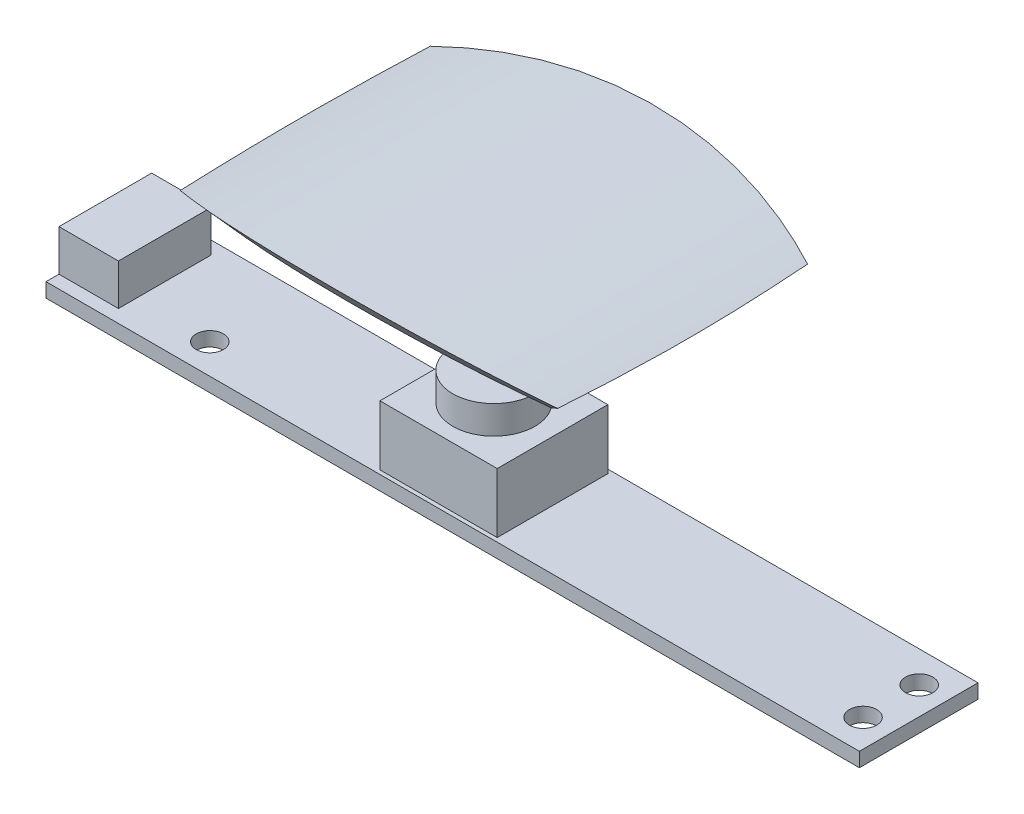
from build123d import *

# Parameters (mm, degrees)
SKETCH1_W                = 62.1792
SKETCH1_H                = 9.0678
SKETCH1_R                = 1.0414
BOSS_EXTRUDE1_DEPTH      = 1.0922
SKETCH2_W                = 4.5466
SKETCH2_H                = 7.0866
BOSS_EXTRUDE2_DEPTH      = 3.1496
SKETCH3_W                = 8.9662
SKETCH3_H                = 8.4582
BOSS_EXTRUDE3_DEPTH      = 4.572
BOSS_EXTRUDE4_DEPTH      = 2.159
BOSS_EXTRUDE5_DEPTH      = 50.8
BOSS_EXTRUDE5_DEPTH_BACK = 50.8
SKETCH11_R               = 52.324
SKETCH11_R_2             = 50.8


with BuildPart() as part:
    # Sketch1 → Boss-Extrude1 (new body)
    with BuildSketch(Plane(origin=(0, 0, 0), x_dir=(1, 0, 0), z_dir=(0, 1, 0))):
        with Locations((31.0896, 4.5339)):
            Rectangle(SKETCH1_W, SKETCH1_H)
        with Locations(Location((10.2362, 2.286, 0), (0, 0, 270))):
            Circle(SKETCH1_R, mode=Mode.SUBTRACT)
        with Locations(Location((60.071, 6.6802, 0), (0, 0, 270))):
            Circle(SKETCH1_R, mode=Mode.SUBTRACT)
        with Locations(Location((60.071, 2.3876, 0), (0, 0, 270))):
            Circle(SKETCH1_R, mode=Mode.SUBTRACT)
    extrude(amount=BOSS_EXTRUDE1_DEPTH)

    # Sketch2 → Boss-Extrude2 (add)
    with BuildSketch(Plane(origin=(0, 1.0922, 0), x_dir=(1, 0, 0), z_dir=(0, 1, 0))):
        with Locations((2.2733, 4.5339)):
            Rectangle(SKETCH2_W, SKETCH2_H)
    extrude(amount=BOSS_EXTRUDE2_DEPTH)

    # Sketch3 → Boss-Extrude3 (add)
    with BuildSketch(Plane(origin=(0, 1.0922, 0), x_dir=(1, 0, 0), z_dir=(0, 1, 0))):
        with Locations((29.7053, 4.5339)):
            Rectangle(SKETCH3_W, SKETCH3_H)
    extrude(amount=BOSS_EXTRUDE3_DEPTH)

    # Sketch4 → Boss-Extrude4 (add)
    with BuildSketch(Plane(origin=(0, 5.6642, 0), x_dir=(1, 0, 0), z_dir=(0, 1, 0))):
        with BuildLine():
            ThreePointArc((32.8422, 4.5339), (30.863379034, 7.449203511), (27.423477974, 6.686440325))
            Line((27.423477974, 6.686440325), (31.987122026, 2.381359675))
            ThreePointArc((31.987122026, 2.381359675), (32.620603511, 3.375820966), (32.8422, 4.5339))
        make_face()
        with BuildLine():
            Line((31.987122026, 2.381359675), (27.423477974, 6.686440325))
            ThreePointArc((27.423477974, 6.686440325), (27.552759675, 2.252077974), (31.987122026, 2.381359675))
        make_face()
    extrude(amount=BOSS_EXTRUDE4_DEPTH)


with BuildPart() as body_2:
    # Loft1: read off the stored shape, not the designer's step
    # Loft1: loft between two sections, ruled curve by curve
    loft1_from = [
        Edge.make_bspline([(-17.815038703, 43.7642, -36.004399795), (-13.855010478, 43.7642, -36.004399795), (-9.894982253, 43.7642, -36.004399795), (-1.974925802, 43.7642, -36.004399795), (1.985102423, 43.7642, -36.004399795), (9.905158874, 43.7642, -36.004399795), (13.865187099, 43.7642, -36.004399795), (21.785243549, 43.7642, -36.004399795), (25.745271775, 43.7642, -36.004399795), (33.665328225, 43.7642, -36.004399795), (37.625356451, 43.7642, -36.004399795), (45.545412901, 43.7642, -36.004399795), (49.505441126, 43.7642, -36.004399795), (57.425497577, 43.7642, -36.004399795), (61.385525802, 43.7642, -36.004399795), (69.305582253, 43.7642, -36.004399795), (73.265610478, 43.7642, -36.004399795), (77.225638703, 43.7642, -36.004399795)], [0, 0, 0, 0, 0.125, 0.125, 0.25, 0.25, 0.375, 0.375, 0.5, 0.5, 0.625, 0.625, 0.75, 0.75, 0.875, 0.875, 1, 1, 1, 1], 3),
        Edge.make_bspline([(77.225638703, 43.7642, -36.004399795), (77.225638703, 43.7642, -30.759316496), (77.225638703, 43.7642, -25.514233197), (77.225638703, 43.7642, -15.024066598), (77.225638703, 43.7642, -9.778983299), (77.225638703, 43.7642, 0.711183299), (77.225638703, 43.7642, 5.956266598), (77.225638703, 43.7642, 16.446433197), (77.225638703, 43.7642, 21.691516496), (77.225638703, 43.7642, 26.936599795)], [0, 0, 0, 0, 0.25, 0.25, 0.5, 0.5, 0.75, 0.75, 1, 1, 1, 1], 3),
        Edge.make_bspline([(-17.815038703, 43.7642, 26.936599795), (-17.815038703, 43.7642, 21.691516496), (-17.815038703, 43.7642, 16.446433197), (-17.815038703, 43.7642, 5.956266598), (-17.815038703, 43.7642, 0.711183299), (-17.815038703, 43.7642, -9.778983299), (-17.815038703, 43.7642, -15.024066598), (-17.815038703, 43.7642, -25.514233197), (-17.815038703, 43.7642, -30.759316496), (-17.815038703, 43.7642, -36.004399795)], [0, 0, 0, 0, 0.25, 0.25, 0.5, 0.5, 0.75, 0.75, 1, 1, 1, 1], 3),
        Edge.make_bspline([(77.225638703, 43.7642, 26.936599795), (73.265610478, 43.7642, 26.936599795), (69.305582253, 43.7642, 26.936599795), (61.385525802, 43.7642, 26.936599795), (57.425497577, 43.7642, 26.936599795), (49.505441126, 43.7642, 26.936599795), (45.545412901, 43.7642, 26.936599795), (37.625356451, 43.7642, 26.936599795), (33.665328225, 43.7642, 26.936599795), (25.745271775, 43.7642, 26.936599795), (21.785243549, 43.7642, 26.936599795), (13.865187099, 43.7642, 26.936599795), (9.905158874, 43.7642, 26.936599795), (1.985102423, 43.7642, 26.936599795), (-1.974925802, 43.7642, 26.936599795), (-9.894982253, 43.7642, 26.936599795), (-13.855010478, 43.7642, 26.936599795), (-17.815038703, 43.7642, 26.936599795)], [0, 0, 0, 0, 0.125, 0.125, 0.25, 0.25, 0.375, 0.375, 0.5, 0.5, 0.625, 0.625, 0.75, 0.75, 0.875, 0.875, 1, 1, 1, 1], 3),
    ]
    loft1_to = [
        Edge.make_bspline([(27.089926276, 7.8232, -6.265939807), (27.210266192, 7.8232, -6.447652637), (27.356593228, 7.8232, -6.627246031), (27.704874025, 7.8232, -6.962236266), (27.906975354, 7.8232, -7.117459947), (28.360359335, 7.8232, -7.379930242), (28.611638214, 7.8232, -7.486888917), (29.143809422, 7.8232, -7.63244288), (29.424466589, 7.8232, -7.6708), (29.986133411, 7.8232, -7.6708), (30.266790578, 7.8232, -7.63244288), (30.798961786, 7.8232, -7.486888917), (31.050240665, 7.8232, -7.379930242), (31.503624646, 7.8232, -7.117459947), (31.705725975, 7.8232, -6.962236266), (32.054006772, 7.8232, -6.627246031), (32.200333808, 7.8232, -6.447652637), (32.320673724, 7.8232, -6.265939807)], [0, 0, 0, 0, 0.125, 0.125, 0.25, 0.25, 0.375, 0.375, 0.5, 0.5, 0.625, 0.625, 0.75, 0.75, 0.875, 0.875, 1, 1, 1, 1], 3),
        Edge.make_bspline([(32.320673724, 7.8232, -6.265939807), (32.480064731, 7.8232, -6.025259974), (32.612503267, 7.8232, -5.751723137), (32.793795146, 7.8232, -5.163282045), (32.8422, 7.8232, -4.848745684), (32.8422, 7.8232, -4.219054316), (32.793795146, 7.8232, -3.904517955), (32.612503267, 7.8232, -3.316076863), (32.480064731, 7.8232, -3.042540026), (32.320673724, 7.8232, -2.801860193)], [0, 0, 0, 0, 0.25, 0.25, 0.5, 0.5, 0.75, 0.75, 1, 1, 1, 1], 3),
        Edge.make_bspline([(27.089926276, 7.8232, -2.801860193), (26.930535269, 7.8232, -3.042540026), (26.798096733, 7.8232, -3.316076863), (26.616804854, 7.8232, -3.904517955), (26.5684, 7.8232, -4.219054316), (26.5684, 7.8232, -4.848745684), (26.616804854, 7.8232, -5.163282045), (26.798096733, 7.8232, -5.751723137), (26.930535269, 7.8232, -6.025259974), (27.089926276, 7.8232, -6.265939807)], [0, 0, 0, 0, 0.25, 0.25, 0.5, 0.5, 0.75, 0.75, 1, 1, 1, 1], 3),
        Edge.make_bspline([(32.320673724, 7.8232, -2.801860193), (32.200333808, 7.8232, -2.620147363), (32.054006772, 7.8232, -2.440553969), (31.705725975, 7.8232, -2.105563734), (31.503624646, 7.8232, -1.950340053), (31.050240665, 7.8232, -1.687869758), (30.798961786, 7.8232, -1.580911083), (30.266790578, 7.8232, -1.43535712), (29.986133411, 7.8232, -1.397), (29.424466589, 7.8232, -1.397), (29.143809422, 7.8232, -1.43535712), (28.611638214, 7.8232, -1.580911083), (28.360359335, 7.8232, -1.687869758), (27.906975354, 7.8232, -1.950340053), (27.704874025, 7.8232, -2.105563734), (27.356593228, 7.8232, -2.440553969), (27.210266192, 7.8232, -2.620147363), (27.089926276, 7.8232, -2.801860193)], [0, 0, 0, 0, 0.125, 0.125, 0.25, 0.25, 0.375, 0.375, 0.5, 0.5, 0.625, 0.625, 0.75, 0.75, 0.875, 0.875, 1, 1, 1, 1], 3),
    ]
    loft1 = Solid(Shell([*[Face.make_surface_from_curves(loft1_from[k], loft1_to[k]) for k in range(4)], Face(Wire(loft1_from)), Face(Wire(loft1_to))]))
    add(loft1)


with BuildPart() as body_3:
    # Sketch11 → Boss-Extrude5 (new, two sides: drawn at the far end of the back side and taken through both)
    with BuildSketch(Plane.XY.offset(-4.5339).offset(-BOSS_EXTRUDE5_DEPTH_BACK)):
        with Locations((29.7053, -33.02)):
            Circle(SKETCH11_R)
        with Locations((29.7053, -33.02)):
            Circle(SKETCH11_R_2, mode=Mode.SUBTRACT)
    extrude(amount=BOSS_EXTRUDE5_DEPTH + BOSS_EXTRUDE5_DEPTH_BACK)


with BuildPart() as body_2_1:
    add(body_2.part)

    # Combine1: intersect body 3
    add(body_3.part, mode=Mode.INTERSECT)


solid = Compound([part.part, body_2_1.part])
